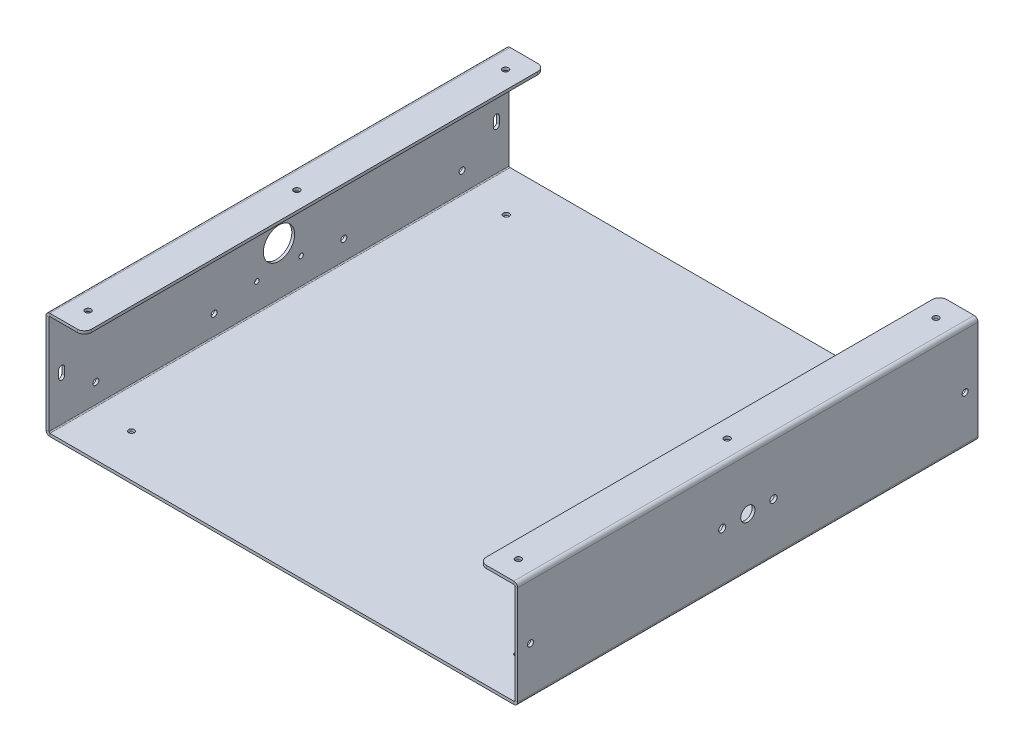
from build123d import *

# Parameters (mm, degrees)
SKETCH1_W                    = 331
SKETCH1_H                    = 2
BASE_FLANGE1_DEPTH           = 161.5
EDGE_FLANGE1_STRIP_W         = 9.4732
EDGE_FLANGE1_STRIP_H         = 2
EDGE_FLANGE1_STRIP_CUT_DEPTH = 323
EDGE_FLANGE1_DEPTH           = 323
EDGE_FLANGE2_STRIP_W         = 9.4732
EDGE_FLANGE2_STRIP_H         = 2
EDGE_FLANGE2_STRIP_CUT_DEPTH = 323
EDGE_FLANGE2_DEPTH           = 323
FILLET1_R                    = 5
CUT_EXTRUDE1_REACH           = 372.202
SKETCH12_R                   = 2.5
SKETCH12_R_2                 = 5
SKETCH12_R_3                 = 2.1
CUT_EXTRUDE2_REACH           = 372.202
SKETCH13_R                   = 11
SKETCH13_R_2                 = 1.6
CUT_EXTRUDE3_REACH           = 245.1
SKETCH14_R                   = 2.1
CUT_EXTRUDE4_REACH           = 245.1
SKETCH15_R                   = 2
SKETCH15_R_2                 = 2.1
SKETCH16_R                   = 2.1
CUT_EXTRUDE5_DEPTH           = 10


# Sheet-metal steps are written as plain solids
with BuildPart() as part:
    # Sketch1 → Base-Flange1 (new, symmetric)
    with BuildSketch(Plane.XY):
        with Locations((0, -36.5)):
            Rectangle(SKETCH1_W, SKETCH1_H)
    extrude(amount=BASE_FLANGE1_DEPTH, both=True)

    # Edge-Flange1 strip (across the edge) → Edge-Flange1 strip cut (cut)
    with BuildSketch(Plane(origin=(165.5, -35.5, 161.5), x_dir=(-1, 0, 0), z_dir=(0, 0, -1))):
        with Locations((-2, -1)):
            Rectangle(EDGE_FLANGE1_STRIP_W, EDGE_FLANGE1_STRIP_H)
    edge_flange1_strip_cut = extrude(amount=EDGE_FLANGE1_STRIP_CUT_DEPTH, mode=Mode.SUBTRACT)

    # Edge-Flange1 section (across the edge) → Edge-Flange1 (add)
    with BuildSketch(Plane(origin=(165.5, -35.5, 161.5), x_dir=(-1, 0, 0), z_dir=(0, 0, -1))):
        with BuildLine():
            Line((0, 0.7366), (0, 73))
            Line((0, 73), (2, 73))
            Line((2, 73), (2, 0.7366))
            ThreePointArc((2, 0.7366), (2.215745145, 0.215745145), (2.7366, 0))
            Line((2.7366, 0), (2.7366, -2))
            ThreePointArc((2.7366, -2), (0.801531583, -1.198468417), (0, 0.7366))
        make_face()
    edge_flange1 = extrude(amount=EDGE_FLANGE1_DEPTH)

    # Mirror1: Edge-Flange1 strip cut, Edge-Flange1 across plane
    add(edge_flange1_strip_cut.mirror(Plane(origin=(0, 0, 0), x_dir=(0, 0, 1), z_dir=(1, 0, 0))), mode=Mode.SUBTRACT)
    add(edge_flange1.mirror(Plane(origin=(0, 0, 0), x_dir=(0, 0, 1), z_dir=(1, 0, 0))))

    # Edge-Flange2 strip (across the edge) → Edge-Flange2 strip cut (cut)
    with BuildSketch(Plane(origin=(163.5, 37.5, 161.5), x_dir=(0, -1, 0), z_dir=(0, 0, -1))):
        with Locations((-2, -1)):
            Rectangle(EDGE_FLANGE2_STRIP_W, EDGE_FLANGE2_STRIP_H)
    edge_flange2_strip_cut = extrude(amount=EDGE_FLANGE2_STRIP_CUT_DEPTH, mode=Mode.SUBTRACT)

    # Edge-Flange2 section (across the edge) → Edge-Flange2 (add)
    with BuildSketch(Plane(origin=(163.5, 37.5, 161.5), x_dir=(0, -1, 0), z_dir=(0, 0, -1))):
        with BuildLine():
            Line((0, 0.7366), (0, 25))
            Line((0, 25), (2, 25))
            Line((2, 25), (2, 0.7366))
            ThreePointArc((2, 0.7366), (2.215745145, 0.215745145), (2.7366, 0))
            Line((2.7366, 0), (2.7366, -2))
            ThreePointArc((2.7366, -2), (0.801531583, -1.198468417), (0, 0.7366))
        make_face()
    edge_flange2 = extrude(amount=EDGE_FLANGE2_DEPTH)

    # Mirror2: Edge-Flange2 strip cut, Edge-Flange2 across plane
    add(edge_flange2_strip_cut.mirror(Plane(origin=(0, 0, 0), x_dir=(0, 0, 1), z_dir=(1, 0, 0))), mode=Mode.SUBTRACT)
    add(edge_flange2.mirror(Plane(origin=(0, 0, 0), x_dir=(0, 0, 1), z_dir=(1, 0, 0))))

    # Fillet1
    fillet1_edges = [part.edges().sort_by_distance(p)[0] for p in [
        (138.5, 36.5, 161.5),
        (138.5, 36.5, -161.5),
        (-138.5, 36.5, -161.5),
        (-138.5, 36.5, 161.5),
    ]]
    fillet(fillet1_edges, radius=FILLET1_R)

    # Sketch12 → Cut-Extrude1 (cut, up to next)
    with BuildSketch(Plane(origin=(165.5, 0, 0), x_dir=(0, 0, -1), z_dir=(1, 0, 0)), mode=Mode.PRIVATE) as cut_extrude1_sk1:
        with Locations(Location((18, -1, 0), (0, 0, 90))):
            Circle(SKETCH12_R)
    cut_extrude1_tool1 = extrude(cut_extrude1_sk1.sketch, amount=-CUT_EXTRUDE1_REACH, mode=Mode.PRIVATE) & part.part
    # Sketch12 → Cut-Extrude1 (cut, up to next)
    with BuildSketch(Plane(origin=(165.5, 0, 0), x_dir=(0, 0, -1), z_dir=(1, 0, 0)), mode=Mode.PRIVATE) as cut_extrude1_sk2:
        with Locations(Location((-18, -1, 0), (0, 0, 90))):
            Circle(SKETCH12_R)
    cut_extrude1_tool2 = extrude(cut_extrude1_sk2.sketch, amount=-CUT_EXTRUDE1_REACH, mode=Mode.PRIVATE) & part.part
    # Sketch12 → Cut-Extrude1 (cut, up to next)
    with BuildSketch(Plane(origin=(165.5, 0, 0), x_dir=(0, 0, -1), z_dir=(1, 0, 0)), mode=Mode.PRIVATE) as cut_extrude1_sk3:
        with Locations(Location((0, -1, 0), (0, 0, 90))):
            Circle(SKETCH12_R_2)
    cut_extrude1_tool3 = extrude(cut_extrude1_sk3.sketch, amount=-CUT_EXTRUDE1_REACH, mode=Mode.PRIVATE) & part.part
    # Sketch12 → Cut-Extrude1 (cut, up to next)
    with BuildSketch(Plane(origin=(165.5, 0, 0), x_dir=(0, 0, -1), z_dir=(1, 0, 0)), mode=Mode.PRIVATE) as cut_extrude1_sk4:
        with Locations(Location((152.5, -3.5, 0), (0, 0, 90))):
            Circle(SKETCH12_R_3)
    cut_extrude1_tool4 = extrude(cut_extrude1_sk4.sketch, amount=-CUT_EXTRUDE1_REACH, mode=Mode.PRIVATE) & part.part
    # Sketch12 → Cut-Extrude1 (cut, up to next)
    with BuildSketch(Plane(origin=(165.5, 0, 0), x_dir=(0, 0, -1), z_dir=(1, 0, 0)), mode=Mode.PRIVATE) as cut_extrude1_sk5:
        with Locations(Location((-152.5, -3.5, 0), (0, 0, 90))):
            Circle(SKETCH12_R_3)
    cut_extrude1_tool5 = extrude(cut_extrude1_sk5.sketch, amount=-CUT_EXTRUDE1_REACH, mode=Mode.PRIVATE) & part.part
    add(cut_extrude1_tool1.solids().sort_by_distance((165.5, -1, -18))[0], mode=Mode.SUBTRACT)
    add(cut_extrude1_tool2.solids().sort_by_distance((165.5, -1, 18))[0], mode=Mode.SUBTRACT)
    add(cut_extrude1_tool3.solids().sort_by_distance((165.5, -1, 0))[0], mode=Mode.SUBTRACT)
    add(cut_extrude1_tool4.solids().sort_by_distance((165.5, -3.5, -152.5))[0], mode=Mode.SUBTRACT)
    add(cut_extrude1_tool5.solids().sort_by_distance((165.5, -3.5, 152.5))[0], mode=Mode.SUBTRACT)

    # Sketch13 → Cut-Extrude2 (cut, up to next)
    with BuildSketch(Plane.ZY.offset(165.5), mode=Mode.PRIVATE) as cut_extrude2_sk1:
        with Locations(Location((0, -1, 0), (0, 0, 270))):
            Circle(SKETCH13_R)
    cut_extrude2_tool1 = extrude(cut_extrude2_sk1.sketch, amount=-CUT_EXTRUDE2_REACH, mode=Mode.PRIVATE) & part.part
    # Sketch13 → Cut-Extrude2 (cut, up to next)
    with BuildSketch(Plane.ZY.offset(165.5), mode=Mode.PRIVATE) as cut_extrude2_sk2:
        with Locations(Location((-15.5, 14.5, 0), (0, 0, 270))):
            Circle(SKETCH13_R_2)
    cut_extrude2_tool2 = extrude(cut_extrude2_sk2.sketch, amount=-CUT_EXTRUDE2_REACH, mode=Mode.PRIVATE) & part.part
    # Sketch13 → Cut-Extrude2 (cut, up to next)
    with BuildSketch(Plane.ZY.offset(165.5), mode=Mode.PRIVATE) as cut_extrude2_sk3:
        with Locations(Location((15.5, 14.5, 0), (0, 0, 270))):
            Circle(SKETCH13_R_2)
    cut_extrude2_tool3 = extrude(cut_extrude2_sk3.sketch, amount=-CUT_EXTRUDE2_REACH, mode=Mode.PRIVATE) & part.part
    # Sketch13 → Cut-Extrude2 (cut, up to next)
    with BuildSketch(Plane.ZY.offset(165.5), mode=Mode.PRIVATE) as cut_extrude2_sk4:
        with Locations(Location((-15.5, -16.5, 0), (0, 0, 270))):
            Circle(SKETCH13_R_2)
    cut_extrude2_tool4 = extrude(cut_extrude2_sk4.sketch, amount=-CUT_EXTRUDE2_REACH, mode=Mode.PRIVATE) & part.part
    # Sketch13 → Cut-Extrude2 (cut, up to next)
    with BuildSketch(Plane.ZY.offset(165.5), mode=Mode.PRIVATE) as cut_extrude2_sk5:
        with Locations(Location((15.5, -16.5, 0), (0, 0, 270))):
            Circle(SKETCH13_R_2)
    cut_extrude2_tool5 = extrude(cut_extrude2_sk5.sketch, amount=-CUT_EXTRUDE2_REACH, mode=Mode.PRIVATE) & part.part
    # Sketch13 → Cut-Extrude2 (cut, up to next)
    with BuildSketch(Plane.ZY.offset(165.5), mode=Mode.PRIVATE) as cut_extrude2_sk6:
        with BuildLine():
            Line((154.6, -6), (154.6, -1))
            ThreePointArc((154.6, -1), (152.5, 1.1), (150.4, -1))
            Line((150.4, -1), (150.4, -6))
            ThreePointArc((150.4, -6), (152.5, -8.1), (154.6, -6))
        make_face()
    cut_extrude2_tool6 = extrude(cut_extrude2_sk6.sketch, amount=-CUT_EXTRUDE2_REACH, mode=Mode.PRIVATE) & part.part
    # Sketch13 → Cut-Extrude2 (cut, up to next)
    with BuildSketch(Plane.ZY.offset(165.5), mode=Mode.PRIVATE) as cut_extrude2_sk7:
        with BuildLine():
            Line((-150.4, -6), (-150.4, -1))
            ThreePointArc((-150.4, -1), (-152.5, 1.1), (-154.6, -1))
            Line((-154.6, -1), (-154.6, -6))
            ThreePointArc((-154.6, -6), (-152.5, -8.1), (-150.4, -6))
        make_face()
    cut_extrude2_tool7 = extrude(cut_extrude2_sk7.sketch, amount=-CUT_EXTRUDE2_REACH, mode=Mode.PRIVATE) & part.part
    add(cut_extrude2_tool1.solids().sort_by_distance((-165.5, -1, 0))[0], mode=Mode.SUBTRACT)
    add(cut_extrude2_tool2.solids().sort_by_distance((-165.5, 14.5, -15.5))[0], mode=Mode.SUBTRACT)
    add(cut_extrude2_tool3.solids().sort_by_distance((-165.5, 14.5, 15.5))[0], mode=Mode.SUBTRACT)
    add(cut_extrude2_tool4.solids().sort_by_distance((-165.5, -16.5, -15.5))[0], mode=Mode.SUBTRACT)
    add(cut_extrude2_tool5.solids().sort_by_distance((-165.5, -16.5, 15.5))[0], mode=Mode.SUBTRACT)
    add(cut_extrude2_tool6.solids().sort_by_distance((-165.5, -3.5, 152.5))[0], mode=Mode.SUBTRACT)
    add(cut_extrude2_tool7.solids().sort_by_distance((-165.5, -3.5, -152.5))[0], mode=Mode.SUBTRACT)

    # Sketch14 → Cut-Extrude3 (cut, up to next)
    with BuildSketch(Plane(origin=(0, 37.5, 0), x_dir=(1, 0, 0), z_dir=(0, 1, 0)), mode=Mode.PRIVATE) as cut_extrude3_sk1:
        with Locations(Location((151, 0, 0), (0, 0, 180))):
            Circle(SKETCH14_R)
    cut_extrude3_tool1 = extrude(cut_extrude3_sk1.sketch, amount=-CUT_EXTRUDE3_REACH, mode=Mode.PRIVATE) & part.part
    # Sketch14 → Cut-Extrude3 (cut, up to next)
    with BuildSketch(Plane(origin=(0, 37.5, 0), x_dir=(1, 0, 0), z_dir=(0, 1, 0)), mode=Mode.PRIVATE) as cut_extrude3_sk2:
        with Locations(Location((151, -146.5, 0), (0, 0, 180))):
            Circle(SKETCH14_R)
    cut_extrude3_tool2 = extrude(cut_extrude3_sk2.sketch, amount=-CUT_EXTRUDE3_REACH, mode=Mode.PRIVATE) & part.part
    # Sketch14 → Cut-Extrude3 (cut, up to next)
    with BuildSketch(Plane(origin=(0, 37.5, 0), x_dir=(1, 0, 0), z_dir=(0, 1, 0)), mode=Mode.PRIVATE) as cut_extrude3_sk3:
        with Locations(Location((151, 146.5, 0), (0, 0, 180))):
            Circle(SKETCH14_R)
    cut_extrude3_tool3 = extrude(cut_extrude3_sk3.sketch, amount=-CUT_EXTRUDE3_REACH, mode=Mode.PRIVATE) & part.part
    cut_extrude3_1 = cut_extrude3_tool1.solids().sort_by_distance((151, 37.5, 0))[0]
    add(cut_extrude3_1, mode=Mode.SUBTRACT)
    cut_extrude3_2 = cut_extrude3_tool2.solids().sort_by_distance((151, 37.5, 146.5))[0]
    add(cut_extrude3_2, mode=Mode.SUBTRACT)
    cut_extrude3_3 = cut_extrude3_tool3.solids().sort_by_distance((151, 37.5, -146.5))[0]
    add(cut_extrude3_3, mode=Mode.SUBTRACT)
    cut_extrude3 = cut_extrude3_1 + cut_extrude3_2 + cut_extrude3_3  # Cut-Extrude3 as one shape, for the pattern or mirror that repeats it

    # Mirror3: Cut-Extrude3 across plane
    add(cut_extrude3.mirror(Plane(origin=(0, 0, 0), x_dir=(0, 0, 1), z_dir=(1, 0, 0))), mode=Mode.SUBTRACT)

    # Sketch15 → Cut-Extrude4 (cut, up to next)
    with BuildSketch(Plane.XZ.offset(37.5), mode=Mode.PRIVATE) as cut_extrude4_sk1:
        with Locations(Location((135.5, 131.5, 0), (0, 0, 270))):
            Circle(SKETCH15_R)
    cut_extrude4_tool1 = extrude(cut_extrude4_sk1.sketch, amount=-CUT_EXTRUDE4_REACH, mode=Mode.PRIVATE) & part.part
    # Sketch15 → Cut-Extrude4 (cut, up to next)
    with BuildSketch(Plane.XZ.offset(37.5), mode=Mode.PRIVATE) as cut_extrude4_sk2:
        with Locations(Location((135.5, -131.5, 0), (0, 0, 270))):
            Circle(SKETCH15_R_2)
    cut_extrude4_tool2 = extrude(cut_extrude4_sk2.sketch, amount=-CUT_EXTRUDE4_REACH, mode=Mode.PRIVATE) & part.part
    cut_extrude4_1 = cut_extrude4_tool1.solids().sort_by_distance((135.5, -37.5, 131.5))[0]
    add(cut_extrude4_1, mode=Mode.SUBTRACT)
    cut_extrude4_2 = cut_extrude4_tool2.solids().sort_by_distance((135.5, -37.5, -131.5))[0]
    add(cut_extrude4_2, mode=Mode.SUBTRACT)
    cut_extrude4 = cut_extrude4_1 + cut_extrude4_2  # Cut-Extrude4 as one shape, for the pattern or mirror that repeats it

    # Mirror4: Cut-Extrude4 across plane
    add(cut_extrude4.mirror(Plane(origin=(0, 0, 0), x_dir=(0, 0, 1), z_dir=(1, 0, 0))), mode=Mode.SUBTRACT)

    # Sketch16 → Cut-Extrude5 (cut)
    with BuildSketch(Plane.ZY.offset(165.5)):
        with Locations(Location((-128.5, -21.127323223, 0), (0, 0, 270))):
            Circle(SKETCH16_R)
        with Locations(Location((-128.5, 21.127321678, 0), (0, 0, 270))):
            Circle(SKETCH16_R)
        with Locations(Location((-45.5, -21.127323223, 0), (0, 0, 270))):
            Circle(SKETCH16_R)
        with Locations(Location((-45.5, 21.127321678, 0), (0, 0, 270))):
            Circle(SKETCH16_R)
        with Locations(Location((128.5, -21.127323223, 0), (0, 0, 270))):
            Circle(SKETCH16_R)
        with Locations(Location((128.5, 21.127321678, 0), (0, 0, 270))):
            Circle(SKETCH16_R)
        with Locations(Location((45.5, -21.127323223, 0), (0, 0, 270))):
            Circle(SKETCH16_R)
        with Locations(Location((45.5, 21.127321678, 0), (0, 0, 270))):
            Circle(SKETCH16_R)
    extrude(amount=-CUT_EXTRUDE5_DEPTH, mode=Mode.SUBTRACT)


solid = part.part
